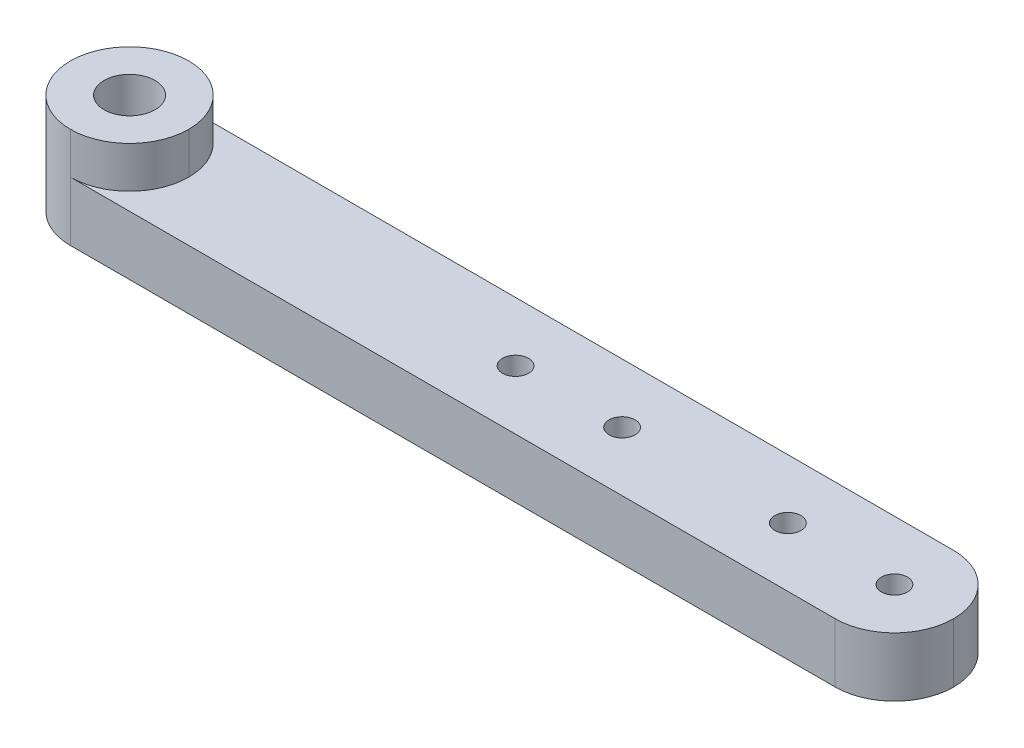
from build123d import *

# Parameters (mm, degrees)
SKETCH_1_W          = 74.6
SKETCH_1_H          = 5
EXTRUDE_1_DEPTH     = 10
SKETCH_4_W          = 10
SKETCH_4_H          = 10
EXTRUDE_2_DEPTH     = 3.5
FILLET_1_R          = 5
SKETCH_2_R          = 2.15
SKETCH_2_R_2        = 1.1
CUT_EXTRUDE_1_DEPTH = 40.541623639


with BuildPart() as part:
    # 스케치1 → 보스-돌출1 (new body)
    with BuildSketch(Plane.XY):
        Rectangle(SKETCH_1_W, SKETCH_1_H)
    extrude(amount=EXTRUDE_1_DEPTH)

    # 스케치4 → 보스-돌출2 (add)
    with BuildSketch(Plane(origin=(0, 2.5, 0), x_dir=(1, 0, 0), z_dir=(0, 1, 0))):
        with Locations((-32.3, -5)):
            Rectangle(SKETCH_4_W, SKETCH_4_H)
    extrude(amount=EXTRUDE_2_DEPTH)

    # 필렛1
    fillet_1_edges = [part.edges().sort_by_distance(p)[0] for p in [
        (37.3, 0, 0),
        (37.3, 0, 10),
        (-37.3, 1.75, 0),
        (-37.3, 1.75, 10),
        (-27.3, 4.25, 10),
        (-27.3, 4.25, 0),
    ]]
    fillet(fillet_1_edges, radius=FILLET_1_R - 0.0001)  # a hair under: the kernel refuses the full size

    # 스케치2 → 컷-돌출1 (cut, through all)
    with BuildSketch(Plane(origin=(0, 6, 0), x_dir=(1, 0, 0), z_dir=(0, 1, 0))):
        with Locations(Location((-32.3, -5, 0), (0, 0, 270))):
            Circle(SKETCH_2_R)
        with Locations(Location((32.3, -5, 0), (0, 0, 270))):
            Circle(SKETCH_2_R_2)
        with Locations(Location((23.3, -5, 0), (0, 0, 270))):
            Circle(SKETCH_2_R_2)
        with Locations(Location((9.3, -5, 0), (0, 0, 270))):
            Circle(SKETCH_2_R_2)
        with Locations(Location((0.3, -5, 0), (0, 0, 270))):
            Circle(SKETCH_2_R_2)
    extrude(amount=-CUT_EXTRUDE_1_DEPTH, mode=Mode.SUBTRACT)


solid = part.part
